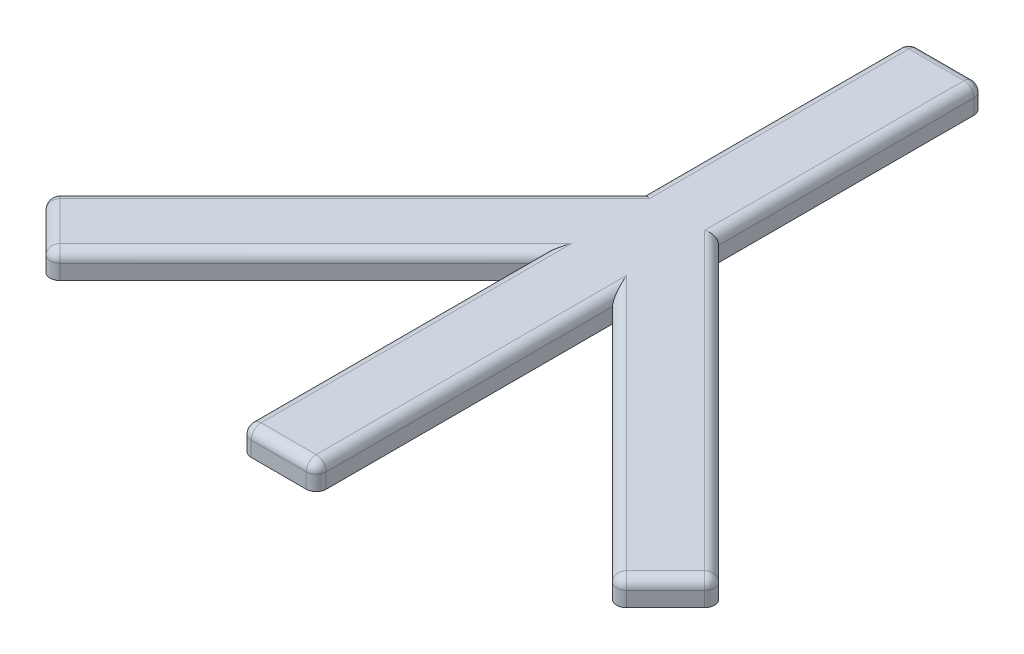
from build123d import *

# Parameters (mm, degrees)
SKETCH1_W           = 15
SKETCH1_H           = 133.387974866
BOSS_EXTRUDE4_DEPTH = 5
FILLET2_R           = 2
FILLET3_R           = 2


with BuildPart() as part:
    # Sketch1 → Boss-Extrude4 (new body)
    with BuildSketch(Plane(origin=(0, 0, 0), x_dir=(1, 0, 0), z_dir=(0, 1, 0))):
        Polygon((-56.591724934, -56.591724934), (-67.198326652, -45.985123216), (-4.122226718, 17.090976718), (6.484375, 6.484375), align=None)
        Rectangle(SKETCH1_W, SKETCH1_H)
        Polygon((56.591724934, -56.591724934), (67.198326652, -45.985123216), (3.579374214, 17.633829222), (-7.027227504, 7.027227504), align=None)
    extrude(amount=BOSS_EXTRUDE4_DEPTH)

    # Fillet2
    fillet2_edges = [part.edges().sort_by_distance(p)[0] for p in [
        (32.045862467, 5, 32.045862467),
        (-32.045862467, 5, 32.045862467),
        (-61.895025793, 5, 51.288424075),
        (-37.349163326, 5, 16.13595989),
        (-7.5, 5, 37.096993717),
        (-7.5, 5, -40.203595434),
        (0, 5, 66.693987433),
        (7.5, 5, 37.096993717),
        (7.5, 5, -40.203595434),
        (0, 5, -66.693987433),
        (61.895025793, 5, 51.288424075),
        (37.349163326, 5, 16.13595989),
    ]]
    fillet(fillet2_edges, radius=FILLET2_R)

    # Fillet3
    # the kernel refuses this fillet: 2 mm, written as the material it takes off along each edge
    with BuildSketch(Plane(origin=(-5.5, 3, 64.693987433), x_dir=(0, 0, 1), z_dir=(-1, 0, 0))) as fillet3_piece_1_section:
        Polygon((0, 0), (FILLET3_R, 0), (FILLET3_R, FILLET3_R), (0, FILLET3_R), align=None)
    fillet3_piece_1 = extrude(amount=FILLET3_R, mode=Mode.PRIVATE)
    fillet3_piece_1 = fillet3_piece_1 - Plane(origin=(-5.5, 3, 64.693987433), x_dir=(0, -0.7071067811865475, -0.7071067811865475), z_dir=(-1, 0, 0)) * Sphere(FILLET3_R, mode=Mode.PRIVATE)
    add(fillet3_piece_1, mode=Mode.SUBTRACT)
    with BuildSketch(Plane(origin=(5.5, 3, 64.693987433), x_dir=(0, 0, 1), z_dir=(1, 0, 0))) as fillet3_piece_2_section:
        Polygon((0, 0), (FILLET3_R, 0), (FILLET3_R, -FILLET3_R), (0, -FILLET3_R), align=None)
    fillet3_piece_2 = extrude(amount=FILLET3_R, mode=Mode.PRIVATE)
    fillet3_piece_2 = fillet3_piece_2 - Plane(origin=(5.5, 3, 64.693987433), x_dir=(0, -0.7071067811865475, -0.7071067811865475), z_dir=(1, 0, 0)) * Sphere(FILLET3_R, mode=Mode.PRIVATE)
    add(fillet3_piece_2, mode=Mode.SUBTRACT)
    with BuildSketch(Plane(origin=(-56.591724934, 3, 53.763297809), x_dir=(0.7071067811865437, 0, 0.7071067811865513), z_dir=(-0.7071067811865476, 0, 0.7071067811865476))) as fillet3_piece_3_section:
        Polygon((0, 0), (FILLET3_R, 0), (FILLET3_R, FILLET3_R), (0, FILLET3_R), align=None)
    fillet3_piece_3 = extrude(amount=FILLET3_R, mode=Mode.PRIVATE)
    fillet3_piece_3 = fillet3_piece_3 - Plane(origin=(-56.591724934, 3, 53.763297809), x_dir=(-0.4999999999999973, -0.7071067811865475, -0.5000000000000027), z_dir=(-0.7071067811865476, 0, 0.7071067811865476)) * Sphere(FILLET3_R, mode=Mode.PRIVATE)
    add(fillet3_piece_3, mode=Mode.SUBTRACT)
    with BuildSketch(Plane(origin=(56.591724934, 3, 53.763297809), x_dir=(-0.7071067811865476, 0, 0.7071067811865476), z_dir=(0.7071067811865479, 0, 0.7071067811865474))) as fillet3_piece_4_section:
        Polygon((0, 0), (FILLET3_R, 0), (FILLET3_R, -FILLET3_R), (0, -FILLET3_R), align=None)
    fillet3_piece_4 = extrude(amount=FILLET3_R, mode=Mode.PRIVATE)
    fillet3_piece_4 = fillet3_piece_4 - Plane(origin=(56.591724934, 3, 53.763297809), x_dir=(0.5, -0.7071067811865475, -0.5), z_dir=(0.7071067811865479, 0, 0.7071067811865474)) * Sphere(FILLET3_R, mode=Mode.PRIVATE)
    add(fillet3_piece_4, mode=Mode.SUBTRACT)
    with BuildSketch(Plane(origin=(-64.369899527, 3, 45.985123216), x_dir=(-0.7071067811865476, 0, -0.7071067811865476), z_dir=(-0.7071067811865476, 0, 0.7071067811865476))) as fillet3_piece_5_section:
        Polygon((0, 0), (FILLET3_R, 0), (FILLET3_R, -FILLET3_R), (0, -FILLET3_R), align=None)
    fillet3_piece_5 = extrude(amount=FILLET3_R, mode=Mode.PRIVATE)
    fillet3_piece_5 = fillet3_piece_5 - Plane(origin=(-64.369899527, 3, 45.985123216), x_dir=(0.5, -0.7071067811865475, 0.5), z_dir=(-0.7071067811865476, 0, 0.7071067811865476)) * Sphere(FILLET3_R, mode=Mode.PRIVATE)
    add(fillet3_piece_5, mode=Mode.SUBTRACT)
    with BuildSketch(Plane(origin=(64.369899527, 3, 45.985123216), x_dir=(0.7071067811865479, 0, 0.7071067811865474), z_dir=(0.7071067811865474, 0, -0.7071067811865478))) as fillet3_piece_6_section:
        Polygon((0, 0), (FILLET3_R, 0), (FILLET3_R, -FILLET3_R), (0, -FILLET3_R), align=None)
    fillet3_piece_6 = extrude(amount=FILLET3_R, mode=Mode.PRIVATE)
    fillet3_piece_6 = fillet3_piece_6 - Plane(origin=(64.369899527, 3, 45.985123216), x_dir=(-0.5000000000000002, -0.7071067811865475, -0.49999999999999983), z_dir=(0.7071067811865474, 0, -0.7071067811865478)) * Sphere(FILLET3_R, mode=Mode.PRIVATE)
    add(fillet3_piece_6, mode=Mode.SUBTRACT)
    with BuildSketch(Plane(origin=(-5.5, 3, -64.693987433), x_dir=(0, 0, -1), z_dir=(-1, 0, 0))) as fillet3_piece_7_section:
        Polygon((0, 0), (FILLET3_R, 0), (FILLET3_R, -FILLET3_R), (0, -FILLET3_R), align=None)
    fillet3_piece_7 = extrude(amount=FILLET3_R, mode=Mode.PRIVATE)
    fillet3_piece_7 = fillet3_piece_7 - Plane(origin=(-5.5, 3, -64.693987433), x_dir=(0, -0.7071067811865475, 0.7071067811865475), z_dir=(-1, 0, 0)) * Sphere(FILLET3_R, mode=Mode.PRIVATE)
    add(fillet3_piece_7, mode=Mode.SUBTRACT)
    with BuildSketch(Plane(origin=(5.5, 3, -64.693987433), x_dir=(1, 0, 0), z_dir=(0, 0, -1))) as fillet3_piece_8_section:
        Polygon((0, 0), (FILLET3_R, 0), (FILLET3_R, -FILLET3_R), (0, -FILLET3_R), align=None)
    fillet3_piece_8 = extrude(amount=FILLET3_R, mode=Mode.PRIVATE)
    fillet3_piece_8 = fillet3_piece_8 - Plane(origin=(5.5, 3, -64.693987433), x_dir=(-0.7071067811865475, -0.7071067811865475, 0), z_dir=(0, 0, -1)) * Sphere(FILLET3_R, mode=Mode.PRIVATE)
    add(fillet3_piece_8, mode=Mode.SUBTRACT)
    with BuildSketch(Plane(origin=(-7.5, -5, -66.693987433), x_dir=(0, 0, 1), z_dir=(0, 1, 0)), Plane(origin=(7.5, -5, -66.693987433), x_dir=(-1, 0, 0), z_dir=(0, 1, 0)), Plane(origin=(67.198326652, -5, 45.985123216), x_dir=(-0.7071067811865476, 0, -0.7071067811865476), z_dir=(0, 1, 0)), Plane(origin=(56.591724934, -5, 56.591724934), x_dir=(0.7071067811865476, 0, -0.7071067811865476), z_dir=(0, 1, 0)), Plane(origin=(7.5, -5, 66.693987433), x_dir=(0, 0, -1), z_dir=(0, 1, 0)), Plane(origin=(-67.198326652, -5, 45.985123216), x_dir=(0.7071067811865476, 0, 0.7071067811865476), z_dir=(0, 1, 0))) as fillet3_piece_9:
        with BuildLine():
            CenterArc((FILLET3_R, FILLET3_R), FILLET3_R, 180, 90)
            Line((0, FILLET3_R), (0, 0))
            Line((0, 0), (FILLET3_R, 0))
        make_face()
    extrude(amount=8, mode=Mode.SUBTRACT)
    with BuildSketch(Plane(origin=(-7.5, -5, 66.693987433), x_dir=(0, 0, -1), z_dir=(0, 1, 0)), Plane(origin=(-56.591724934, -5, 56.591724934), x_dir=(-0.7071067811865476, 0, -0.7071067811865476), z_dir=(0, 1, 0))) as fillet3_piece_10:
        with BuildLine():
            CenterArc((FILLET3_R, -FILLET3_R), FILLET3_R, 90, 90)
            Line((0, -FILLET3_R), (0, 0))
            Line((0, 0), (FILLET3_R, 0))
        make_face()
    extrude(amount=8, mode=Mode.SUBTRACT)


solid = part.part
